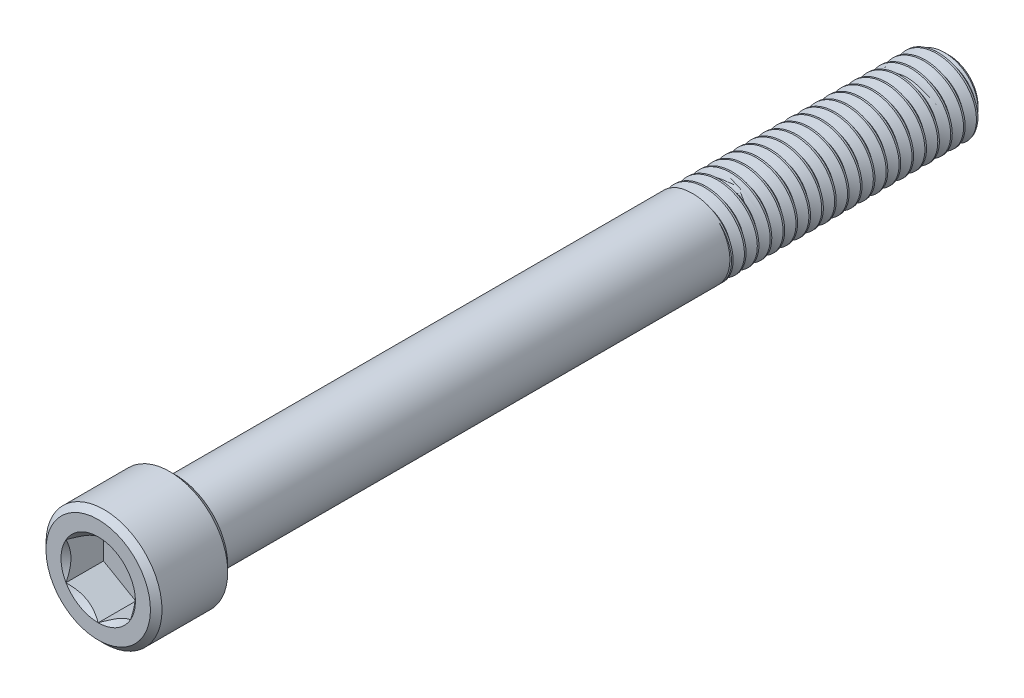
from build123d import *
from build123d.topology import SkipClean

# Parameters (mm, degrees)
CUT_EXTRUDE1_DEPTH  = 4.6228
CHAMFER1_SIZE       = 0.714375
CUT_SWEEP1_PITCH    = 1.5875
CUT_SWEEP1_TO       = 95.25
SKETCH8_R           = 5.159375
BOSS_EXTRUDE1_DEPTH = 2.54
BOSS_EXTRUDE1_TAPER = 60
SKETCH9_R           = 4.7625
BOSS_EXTRUDE2_DEPTH = 63.5


with BuildPart() as part:
    # Sketch3 → Revolve1 (revolve)
    with BuildSketch(Plane(origin=(0, 0, 0), x_dir=(0, 0, -1), z_dir=(1, 0, 0)), mode=Mode.PRIVATE) as revolve1_sk:
        Polygon((-52.3875, 7.14375), (-52.3875, 3.96875), (-47.7647, 3.96875), (-47.7647, 0), (52.3875, 0), (52.3875, 3.571875), (51.196875, 4.7625), (-42.8625, 4.7625), (-42.8625, 7.14375), align=None)
    revolve(revolve1_sk.sketch.rotate(Axis((0, 0, 52.3875), (0, 0, -1)), 180), axis=Axis((0, 0, 52.3875), (0, 0, -1)))

    # Sketch4 → Cut-Extrude1 (cut)
    with BuildSketch(Plane.XY.offset(52.3875)):
        Polygon((0, 4.582717762), (-3.96875, 2.291358881), (-3.96875, -2.291358881), (0, -4.582717762), (3.96875, -2.291358881), (3.96875, 2.291358881), align=None)
    extrude(amount=-CUT_EXTRUDE1_DEPTH, mode=Mode.SUBTRACT)

    # Cut-Extrude2 cone 1 section (through the dimple's axis) → Cut-Extrude2 (revolve, cut)
    with BuildSketch(Plane(origin=(0, 0, 52.3875), x_dir=(0, -1, 0), z_dir=(1, 0, 0))):
        Polygon((0, 0), (4.582717762, 0), (0, 4.582717762), align=None)
    revolve(axis=Axis((0, 0, 52.3875), (0, 0, -1)), mode=Mode.SUBTRACT)

    # Chamfer1
    chamfer1_edges = [part.edges().sort_by_distance(p)[0] for p in [
        (0, 7.14375, 52.3875),
        (0, 7.14375, 42.8625),
    ]]
    chamfer(chamfer1_edges, length=CHAMFER1_SIZE)


with BuildPart() as body_2:
    # Split1: read off the stored shape, not the designer's step
    # Split1: the piece on the far side of the plane
    add(part.part)
    split(bisect_by=Plane.XY.offset(42.8625), keep=Keep.BOTTOM)

    # Cut-Sweep1: arcs per turn and ends read off the stored shape
    # Cut-Sweep1: the profile of Sketch7 screwed along a right-hand helix through 61 turns, 6 arcs to a turn; built about Z, then put on its axis
    cut_sweep1_z = Axis((0, 0, 0), (0, 0, 1))
    cut_sweep1_corners = [(3.731388504, 0, -0.5953125), (3.731388504, 0, -0.79375), (4.848425958, 0, -1.438671875), (4.848425958, 0, 0.049609375)]
    with BuildLine(mode=Mode.PRIVATE) as cut_sweep1_profile:
        Line(cut_sweep1_corners[0], cut_sweep1_corners[1])
        Line(cut_sweep1_corners[1], cut_sweep1_corners[2])
        Line(cut_sweep1_corners[2], cut_sweep1_corners[3])
        Line(cut_sweep1_corners[3], cut_sweep1_corners[0])
    cut_sweep1_cap = Face(cut_sweep1_profile.wire())
    cut_sweep1_turn_angles = [0, 30, 60, 90, 120, 150, 180, 210, 240, 270, 300, 330, 360]
    cut_sweep1_turn_weights = [1, 0.8660254037844387, 1, 0.8660254037844387, 1, 0.8660254037844387, 1, 0.8660254037844387, 1, 0.8660254037844387, 1, 0.8660254037844387, 1]
    cut_sweep1_turn_rails = [Edge.make_bspline([Vector(p[0], p[1], 0).rotate(cut_sweep1_z, cut_sweep1_turn_angles[k]) / cut_sweep1_turn_weights[k] + Vector(0, 0, p[2] + CUT_SWEEP1_PITCH * cut_sweep1_turn_angles[k] / 360) for k in range(13)], [0, 0, 0, 1, 1, 2, 2, 3, 3, 4, 4, 5, 5, 6, 6, 6], 2, cut_sweep1_turn_weights) for p in cut_sweep1_corners]
    cut_sweep1_turn_sides = [Face.make_surface_from_curves(cut_sweep1_turn_rails[p[0]], cut_sweep1_turn_rails[p[1]]) for p in [(0, 1), (1, 2), (2, 3), (3, 0)]]
    cut_sweep1 = Plane(origin=(0, 0, -52.3875), x_dir=(0, 1, 0), z_dir=(0, 0, 1)) * split(Solid(Shell([*[p.moved(Location((0, 0, CUT_SWEEP1_PITCH * i))) for i in range(61) for p in cut_sweep1_turn_sides], cut_sweep1_cap, cut_sweep1_cap.rotate(cut_sweep1_z, 21960).moved(Location((0, 0, CUT_SWEEP1_PITCH * 21960 / 360)))])), bisect_by=Plane.XY.offset(CUT_SWEEP1_TO), keep=Keep.BOTTOM, mode=Mode.PRIVATE)
    add(cut_sweep1, mode=Mode.SUBTRACT)


with BuildPart() as part_1:
    add(part.part)

    # Split1
    split(bisect_by=Plane.XY.offset(42.8625), keep=Keep.TOP)

    add(body_2.part)  # Boss-Extrude1 merges body 2
    # Sketch8 → Boss-Extrude1 (add)
    with BuildSketch(Plane(origin=(0, 0, 42.8625), x_dir=(-1, 0, 0), z_dir=(0, 0, -1))):
        Circle(SKETCH8_R)
    extrude(amount=BOSS_EXTRUDE1_DEPTH, taper=BOSS_EXTRUDE1_TAPER)

    # Sketch9 → Boss-Extrude2 (add)
    with SkipClean():  # the faces are left unmerged after this step: merging them gives an invalid solid
        with BuildSketch(Plane(origin=(0, 0, 42.8625), x_dir=(-1, 0, 0), z_dir=(0, 0, -1))):
            with Locations(Location((0, 0, 0), (0, 0, 90))):
                Circle(SKETCH9_R)
        extrude(amount=BOSS_EXTRUDE2_DEPTH)


solid = part_1.part
